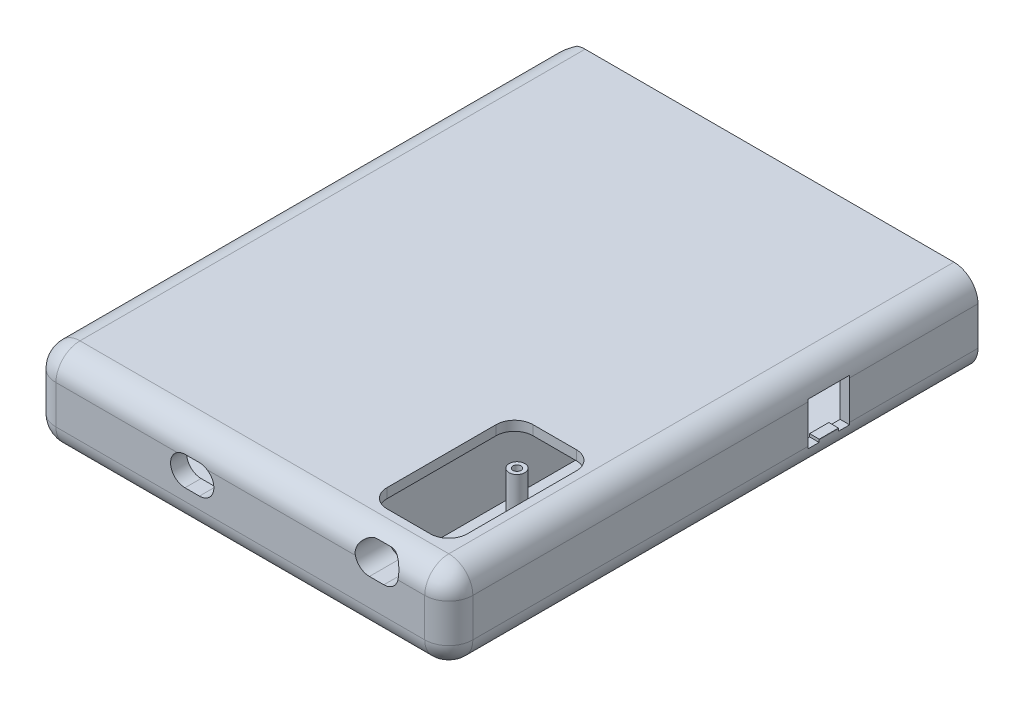
from build123d import *

# Parameters (mm, degrees)
BOSS_EXTRUDE1_DEPTH      = 27
CUT_EXTRUDE1_START       = -5
CUT_EXTRUDE1_DEPTH       = 17
CUT_EXTRUDE2_DEPTH       = 10
FILLET2_R                = 7.5
FILLET3_R                = 7.5
SKETCH4_W                = 80
SKETCH4_H                = 100
BOSS_EXTRUDE2_DEPTH      = 3.5
CHAMFER6_SIZE            = 5
SKETCH6_R                = 2.2
CUT_EXTRUDE3_DEPTH       = 12
CUT_EXTRUDE4_DEPTH       = 22
CUT_EXTRUDE5_REACH       = 213.788
BOSS_EXTRUDE4_DEPTH      = 13
BOSS_EXTRUDE4_DEPTH_BACK = 3
SKETCH12_R               = 2.45
SKETCH12_R_2             = 1.25
SKETCH14_R               = 1.8
CUT_EXTRUDE6_DEPTH       = 3
SKETCH15_R               = 2.25
CUT_EXTRUDE7_DEPTH       = 2
CHAMFER7_SIZE            = 3.936989859
CHAMFER7_SIZE_2          = 45
CUT_EXTRUDE8_DEPTH       = 10
BOSS_EXTRUDE5_START      = -17.5
SKETCH18_W               = 4.75
SKETCH18_H               = 12.5
SKETCH18_R               = 0.75
BOSS_EXTRUDE5_DEPTH      = 15
BOSS_EXTRUDE6_START      = -11
SKETCH19_W               = 3.5
SKETCH19_H               = 8
BOSS_EXTRUDE6_DEPTH      = 3
CHAMFER9_SIZE2           = 8
CHAMFER9_SIZE            = 29.856406461
CHAMFER8_SIZE            = 5.543090515
CHAMFER8_SIZE_2          = 10
BOSS_EXTRUDE7_START      = -4.5
SKETCH20_W               = 5.5
SKETCH20_H               = 6
BOSS_EXTRUDE7_DEPTH      = 10
CHAMFER11_SIZE2          = 6
CHAMFER11_SIZE           = 24.064685601
CUT_EXTRUDE9_DEPTH       = 3
SKETCH22_R               = 2.5
CUT_EXTRUDE10_DEPTH      = 3


# Some blends are built 0.0001 mm under size
with BuildPart() as part:
    # Sketch1 → Boss-Extrude1 (new body)
    with BuildSketch(Plane(origin=(0, 0, 0), x_dir=(1, 0, 0), z_dir=(0, 1, 0))):
        with BuildLine():
            Line((0, 0), (130, 0))
            Line((130, 0), (130, -157.5))
            ThreePointArc((130, -157.5), (127.803300859, -162.803300859), (122.5, -165))
            Line((122.5, -165), (7.5, -165))
            ThreePointArc((7.5, -165), (2.196699141, -162.803300859), (0, -157.5))
            Line((0, -157.5), (0, 0))
        make_face()
    extrude(amount=BOSS_EXTRUDE1_DEPTH)

    # Sketch2 → Cut-Extrude1 (cut)
    with BuildSketch(Plane(origin=(0, 27, 0), x_dir=(1, 0, 0), z_dir=(0, 1, 0)).offset(CUT_EXTRUDE1_START)):
        with BuildLine():
            Line((10, 0), (90, 0))
            Line((90, 0), (90, -152.5))
            ThreePointArc((90, -152.5), (87.803300859, -157.803300859), (82.5, -160))
            Line((82.5, -160), (17.5, -160))
            ThreePointArc((17.5, -160), (12.196699141, -157.803300859), (10, -152.5))
            Line((10, -152.5), (10, 0))
        make_face()
    extrude(amount=-CUT_EXTRUDE1_DEPTH, mode=Mode.SUBTRACT)

    # Sketch3 → Cut-Extrude2 (cut)
    with BuildSketch(Plane(origin=(0, 0, 160), x_dir=(-1, 0, 0), z_dir=(0, 0, -1))):
        with BuildLine():
            Line((-52.25, 20.2), (-47.75, 20.2))
            ThreePointArc((-47.75, 20.2), (-43.25, 15.7), (-47.75, 11.2))
            Line((-47.75, 11.2), (-52.25, 11.2))
            ThreePointArc((-52.25, 11.2), (-56.75, 15.7), (-52.25, 20.2))
        make_face()
    extrude(amount=-CUT_EXTRUDE2_DEPTH, mode=Mode.SUBTRACT)

    # Fillet2
    fillet2_edges = [part.edges().sort_by_distance(p)[0] for p in [
        (130, 0, 78.75),
        (127.803300859, 0, 162.803300859),
        (65, 0, 165),
        (2.196699141, 0, 162.803300859),
        (0, 0, 78.75),
    ]]
    fillet(fillet2_edges, radius=FILLET2_R)

    # Fillet3
    # the kernel refuses this fillet: 7.5 mm, written as the material it takes off along each edge
    with BuildSketch(Plane(origin=(122.5, 27, 165), x_dir=(0, 0, -1), z_dir=(-1, 0, 0))) as fillet3_piece_1:
        with BuildLine():
            CenterArc((FILLET3_R, FILLET3_R), FILLET3_R, 180, 90)
            Line((0, FILLET3_R), (0, 0))
            Line((0, 0), (FILLET3_R, 0))
        make_face()
    extrude(amount=115, mode=Mode.SUBTRACT)
    with BuildSketch(Plane(origin=(130, 27, -18.75), x_dir=(-1, 0, 0), z_dir=(0, 0, 1))) as fillet3_piece_2:
        with BuildLine():
            CenterArc((FILLET3_R, FILLET3_R), FILLET3_R, 180, 90)
            Line((0, FILLET3_R), (0, 0))
            Line((0, 0), (FILLET3_R, 0))
        make_face()
    extrude(amount=176.25, mode=Mode.SUBTRACT)
    with BuildSketch(Plane(origin=(0, 27, 157.5), x_dir=(0, -1, 0), z_dir=(0, 0, -1))) as fillet3_piece_3:
        with BuildLine():
            CenterArc((FILLET3_R, -FILLET3_R), FILLET3_R, 90, 90)
            Line((0, -FILLET3_R), (0, 0))
            Line((0, 0), (FILLET3_R, 0))
        make_face()
    extrude(amount=176.25, mode=Mode.SUBTRACT)
    with BuildSketch(Plane(origin=(122.5, 27, 157.5), x_dir=(1, 0, 0), z_dir=(0, 0, -1))) as fillet3_piece_4:
        with BuildLine():
            CenterArc((7.5 - FILLET3_R, FILLET3_R), FILLET3_R, 270, 90)
            Line((7.5, FILLET3_R), (7.5, 0))
            Line((7.5, 0), (7.5 - FILLET3_R, 0))
        make_face()
    revolve(axis=Axis((122.5, 27, 157.5), (0, -1, 0)), revolution_arc=90, mode=Mode.SUBTRACT)
    with BuildSketch(Plane(origin=(7.5, 27, 157.5), x_dir=(0, 0, 1), z_dir=(1, 0, 0))) as fillet3_piece_5:
        with BuildLine():
            CenterArc((7.5 - FILLET3_R, FILLET3_R), FILLET3_R, 270, 90)
            Line((7.5 - FILLET3_R, 0), (7.5, 0))
            Line((7.5, 0), (7.5, FILLET3_R))
        make_face()
    revolve(axis=Axis((7.5, 27, 157.5), (0, -1, 0)), revolution_arc=90, mode=Mode.SUBTRACT)

    # Sketch4 → Boss-Extrude2 (add)
    with BuildSketch(Plane(origin=(0, 5, 0), x_dir=(1, 0, 0), z_dir=(0, 1, 0))):
        with Locations((50, -110)):
            Rectangle(SKETCH4_W, SKETCH4_H)
    extrude(amount=BOSS_EXTRUDE2_DEPTH)

    # Chamfer6
    # the kernel refuses this chamfer: 5 mm, written as the material it takes off along each edge
    with BuildSketch(Plane(origin=(0, -5.35841494, 0), x_dir=(-0.027495876610586254, 0, 0.9996219169112968), z_dir=(0, 1, 0))) as chamfer6_piece_1:
        Polygon((CHAMFER6_SIZE * 0.999621916911, CHAMFER6_SIZE * 0.0274958766106), (-CHAMFER6_SIZE * 0.0274958766106, CHAMFER6_SIZE * 0.999621916911), (0, 0), align=None)
    extrude(amount=37.71682988, mode=Mode.SUBTRACT)

    # Sketch6 → Cut-Extrude3 (cut)
    with BuildSketch(Plane(origin=(0, 0, 0), x_dir=(-1, 0, 0), z_dir=(0, 0, -1))):
        with Locations((-5, 22)):
            Circle(SKETCH6_R)
        with Locations((-5, 5)):
            Circle(SKETCH6_R)
    extrude(amount=-CUT_EXTRUDE3_DEPTH, mode=Mode.SUBTRACT)

    # Sketch9 → Cut-Extrude4 (cut)
    with BuildSketch(Plane(origin=(0, 27, 0), x_dir=(1, 0, 0), z_dir=(0, 1, 0))):
        with BuildLine():
            Line((100.75, -109.5), (114.25, -109.5))
            ThreePointArc((114.25, -109.5), (118.315863992, -111.184136008), (120, -115.25))
            Line((120, -115.25), (120, -149.25))
            ThreePointArc((120, -149.25), (118.315863992, -153.315863992), (114.25, -155))
            Line((114.25, -155), (100.75, -155))
            ThreePointArc((100.75, -155), (96.684136008, -153.315863992), (95, -149.25))
            Line((95, -149.25), (95, -115.25))
            ThreePointArc((95, -115.25), (96.684136008, -111.184136008), (100.75, -109.5))
        make_face()
    extrude(amount=-CUT_EXTRUDE4_DEPTH, mode=Mode.SUBTRACT)

    # Cut-Extrude5: up to this face of the body (flat: up to its plane)
    cut_extrude5_end = Plane(part.part.faces().sort_by_distance((107.5, 16, 155))[0])
    # Sketch11 → Cut-Extrude5 (cut, up to the picked face)
    with BuildSketch(Plane(origin=(0, 0, 0), x_dir=(-1, 0, 0), z_dir=(0, 0, -1)), mode=Mode.PRIVATE) as cut_extrude5_sk1:
        Polygon((-127, 16.5), (-127, 3), (-93, 3), (-93, 24), (-127, 24), align=None)
    cut_extrude5_tool1 = split(extrude(cut_extrude5_sk1.sketch, amount=-CUT_EXTRUDE5_REACH, mode=Mode.PRIVATE), bisect_by=cut_extrude5_end, keep=Keep.BOTH, mode=Mode.PRIVATE)
    add(cut_extrude5_tool1.solids().sort_by(Axis((110, 13.5, 0), (0, 0, 1)))[0], mode=Mode.SUBTRACT)

    # Sketch12 → Boss-Extrude4 (add, two sides: drawn at the far end of the back side and taken through both)
    # profile 1 of 4: a face of its own
    with BuildSketch(Plane(origin=(0, 3, 0), x_dir=(1, 0, 0), z_dir=(0, 1, 0)).offset(-BOSS_EXTRUDE4_DEPTH_BACK)):
        with Locations(Location((99, -112.75, 0), (0, 0, 180))):
            Circle(SKETCH12_R)
        with Locations(Location((99, -112.75, 0), (0, 0, 180))):
            Circle(SKETCH12_R_2, mode=Mode.SUBTRACT)
    # profile 2 of 4: a face of its own
    with BuildSketch(Plane(origin=(0, 3, 0), x_dir=(1, 0, 0), z_dir=(0, 1, 0)).offset(-BOSS_EXTRUDE4_DEPTH_BACK)):
        with Locations(Location((116, -112.75, 0), (0, 0, 180))):
            Circle(SKETCH12_R)
        with Locations(Location((116, -112.75, 0), (0, 0, 180))):
            Circle(SKETCH12_R_2, mode=Mode.SUBTRACT)
    # profile 3 of 4: a face of its own
    with BuildSketch(Plane(origin=(0, 3, 0), x_dir=(1, 0, 0), z_dir=(0, 1, 0)).offset(-BOSS_EXTRUDE4_DEPTH_BACK)):
        with Locations(Location((99, -151.75, 0), (0, 0, 180))):
            Circle(SKETCH12_R)
        with Locations(Location((99, -151.75, 0), (0, 0, 180))):
            Circle(SKETCH12_R_2, mode=Mode.SUBTRACT)
    # profile 4 of 4: a face of its own
    with BuildSketch(Plane(origin=(0, 3, 0), x_dir=(1, 0, 0), z_dir=(0, 1, 0)).offset(-BOSS_EXTRUDE4_DEPTH_BACK)):
        with Locations(Location((116, -151.75, 0), (0, 0, 180))):
            Circle(SKETCH12_R)
        with Locations(Location((116, -151.75, 0), (0, 0, 180))):
            Circle(SKETCH12_R_2, mode=Mode.SUBTRACT)
    extrude(amount=BOSS_EXTRUDE4_DEPTH + BOSS_EXTRUDE4_DEPTH_BACK)

    # Sketch14 → Cut-Extrude6 (cut)
    with BuildSketch(Plane(origin=(0, 3, 0), x_dir=(1, 0, 0), z_dir=(0, 1, 0))):
        with Locations(Location((99, -112.75, 0), (0, 0, 180))):
            Circle(SKETCH14_R)
        with Locations(Location((116, -112.75, 0), (0, 0, 180))):
            Circle(SKETCH14_R)
        with Locations(Location((99, -151.75, 0), (0, 0, 180))):
            Circle(SKETCH14_R)
        with Locations(Location((116, -151.75, 0), (0, 0, 180))):
            Circle(SKETCH14_R)
    extrude(amount=-CUT_EXTRUDE6_DEPTH, mode=Mode.SUBTRACT)

    # Sketch15 → Cut-Extrude7 (cut)
    with BuildSketch(Plane.XZ):
        with Locations(Location((99, 151.75, 0), (0, 0, 270))):
            Circle(SKETCH15_R)
        with Locations(Location((116, 151.75, 0), (0, 0, 270))):
            Circle(SKETCH15_R)
        with Locations(Location((116, 112.75, 0), (0, 0, 270))):
            Circle(SKETCH15_R)
        with Locations(Location((99, 112.75, 0), (0, 0, 270))):
            Circle(SKETCH15_R)
    extrude(amount=-CUT_EXTRUDE7_DEPTH, mode=Mode.SUBTRACT)

    # Chamfer7
    # the kernel refuses this chamfer: 45, 3.936989859 mm, written as the material it takes off along each edge
    with BuildSketch(Plane(origin=(10, 8.5, 60), x_dir=(0, -0.9159861691531135, -0.4012098427509022), z_dir=(1, 0, 0))) as chamfer7_piece_1_section:
        Polygon((CHAMFER7_SIZE * 0.915986169076, -CHAMFER7_SIZE * 0.401209842717), (-CHAMFER7_SIZE_2 * 0.401209842751, -CHAMFER7_SIZE_2 * 0.915986169153), (0, 0), align=None)
    chamfer7_piece_1 = extrude(amount=80, mode=Mode.PRIVATE)
    chamfer7_piece_1 = split(chamfer7_piece_1, bisect_by=Plane(origin=(12.470912859, 5, 75.231072339), z_dir=(0, 1, 0)), keep=Keep.TOP, mode=Mode.PRIVATE)
    add(chamfer7_piece_1, mode=Mode.SUBTRACT)

    # Sketch16 → Cut-Extrude8 (cut)
    with BuildSketch(Plane.XY.offset(165)):
        with BuildLine():
            Line((105.25, 25), (109.75, 25))
            ThreePointArc((109.75, 25), (114.25, 20.5), (109.75, 16))
            Line((109.75, 16), (105.25, 16))
            ThreePointArc((105.25, 16), (100.75, 20.5), (105.25, 25))
        make_face()
    extrude(amount=-CUT_EXTRUDE8_DEPTH, mode=Mode.SUBTRACT)

    # Sketch18 → Boss-Extrude5 (add)
    # profile 1 of 2: a face of its own
    with BuildSketch(Plane(origin=(0, 0, 0), x_dir=(-1, 0, 0), z_dir=(0, 0, -1)).offset(BOSS_EXTRUDE5_START)):
        with Locations((-124.625, 9.25)):
            Rectangle(SKETCH18_W, SKETCH18_H)
        with Locations((-124, 9.25)):
            Circle(SKETCH18_R, mode=Mode.SUBTRACT)
    # profile 2 of 2: a face of its own
    with BuildSketch(Plane(origin=(0, 0, 0), x_dir=(-1, 0, 0), z_dir=(0, 0, -1)).offset(BOSS_EXTRUDE5_START)):
        with Locations((-95.375, 9.25)):
            Rectangle(SKETCH18_W, SKETCH18_H)
        with Locations((-96, 9.25)):
            Circle(SKETCH18_R, mode=Mode.SUBTRACT)
    extrude(amount=-BOSS_EXTRUDE5_DEPTH)

    # Sketch19 → Boss-Extrude6 (add)
    with BuildSketch(Plane(origin=(0, 0, 0), x_dir=(-1, 0, 0), z_dir=(0, 0, -1)).offset(BOSS_EXTRUDE6_START)):
        with Locations((-123, 20)):
            Rectangle(SKETCH19_W, SKETCH19_H)
    extrude(amount=-BOSS_EXTRUDE6_DEPTH)

    # Chamfer9
    chamfer9_edges = [part.edges().sort_by_distance(p)[0] for p in [
        (123, 24, 14),
    ]]
    chamfer9_side = [part.faces().sort_by_distance(p)[0] for p in [
        (123, 24, 14.16),
    ]]
    chamfer(chamfer9_edges, length=CHAMFER9_SIZE - 0.0001, length2=CHAMFER9_SIZE2 - 0.0001, reference=chamfer9_side[0])  # a hair under: the kernel refuses the full size

    # Chamfer8
    # the kernel refuses this chamfer: 10, 5.543090515 mm, written as the material it takes off along each edge
    with BuildSketch(Plane(origin=(97.75, 3, 32.5), x_dir=(-0.9981458389905736, 0, 0.060867759165288256), z_dir=(0, 1, 0))) as chamfer8_piece_1_section:
        Polygon((CHAMFER8_SIZE * 0.998145838906, -CHAMFER8_SIZE * 0.0608677591601), (-CHAMFER8_SIZE_2 * 0.0608677591653, -CHAMFER8_SIZE_2 * 0.998145838991), (0, 0), align=None)
    chamfer8_piece_1 = extrude(amount=12.5, mode=Mode.PRIVATE)
    chamfer8_piece_1 = split(chamfer8_piece_1, bisect_by=Plane(origin=(93, 13.416666667, 29.674431734), z_dir=(1, 0, 0)), keep=Keep.TOP, mode=Mode.PRIVATE)
    add(chamfer8_piece_1, mode=Mode.SUBTRACT)
    with BuildSketch(Plane(origin=(122.25, 3, 32.5), x_dir=(0.9981458389905736, 0, 0.060867759165288256), z_dir=(0, 1, 0))) as chamfer8_piece_2_section:
        Polygon((CHAMFER8_SIZE * 0.998145838906, CHAMFER8_SIZE * 0.0608677591601), (-CHAMFER8_SIZE_2 * 0.0608677591653, CHAMFER8_SIZE_2 * 0.998145838991), (0, 0), align=None)
    chamfer8_piece_2 = extrude(amount=38.379161218, mode=Mode.PRIVATE)
    chamfer8_piece_2 = split(chamfer8_piece_2, bisect_by=Plane(origin=(127, 7.869740247, 30.588424754), z_dir=(-1, 0, 0)), keep=Keep.TOP, mode=Mode.PRIVATE)
    chamfer8_piece_2 = split(chamfer8_piece_2, bisect_by=Plane(origin=(125.673883592, 19.602551791, 27.444656144), z_dir=(0, -0.9659264183795192, 0.2588168353807653)), keep=Keep.TOP, mode=Mode.PRIVATE)
    add(chamfer8_piece_2, mode=Mode.SUBTRACT)

    # Sketch20 → Boss-Extrude7 (add)
    with BuildSketch(Plane(origin=(0, 0, 0), x_dir=(-1, 0, 0), z_dir=(0, 0, -1)).offset(BOSS_EXTRUDE7_START)):
        with Locations((-113.75, 21)):
            Rectangle(SKETCH20_W, SKETCH20_H)
    extrude(amount=-BOSS_EXTRUDE7_DEPTH)

    # Chamfer11
    chamfer11_edges = [part.edges().sort_by_distance(p)[0] for p in [
        (113.75, 24, 14.5),
    ]]
    chamfer11_side = [part.faces().sort_by_distance(p)[0] for p in [
        (113.75, 24, 14.62),
    ]]
    chamfer(chamfer11_edges, length=CHAMFER11_SIZE - 0.0001, length2=CHAMFER11_SIZE2 - 0.0001, reference=chamfer11_side[0])  # a hair under: the kernel refuses the full size

    # Sketch21 → Cut-Extrude9 (cut)
    with BuildSketch(Plane(origin=(130, 0, 0), x_dir=(0, 0, -1), z_dir=(1, 0, 0))):
        Polygon((-49.5, 6.8), (-49.5, 7.7), (-43.5, 7.7), (-43.5, 6.8), (-40, 6.8), (-40, 20.2), (-53, 20.2), (-53, 6.8), align=None)
    extrude(amount=-CUT_EXTRUDE9_DEPTH, mode=Mode.SUBTRACT)

    # Sketch22 → Cut-Extrude10 (cut)
    with BuildSketch(Plane(origin=(0, 0, 160), x_dir=(-1, 0, 0), z_dir=(0, 0, -1))):
        with Locations((-74.75, 14.75)):
            Circle(SKETCH22_R)
        with Locations((-25.25, 14.75)):
            Circle(SKETCH22_R)
    extrude(amount=-CUT_EXTRUDE10_DEPTH, mode=Mode.SUBTRACT)


solid = part.part
